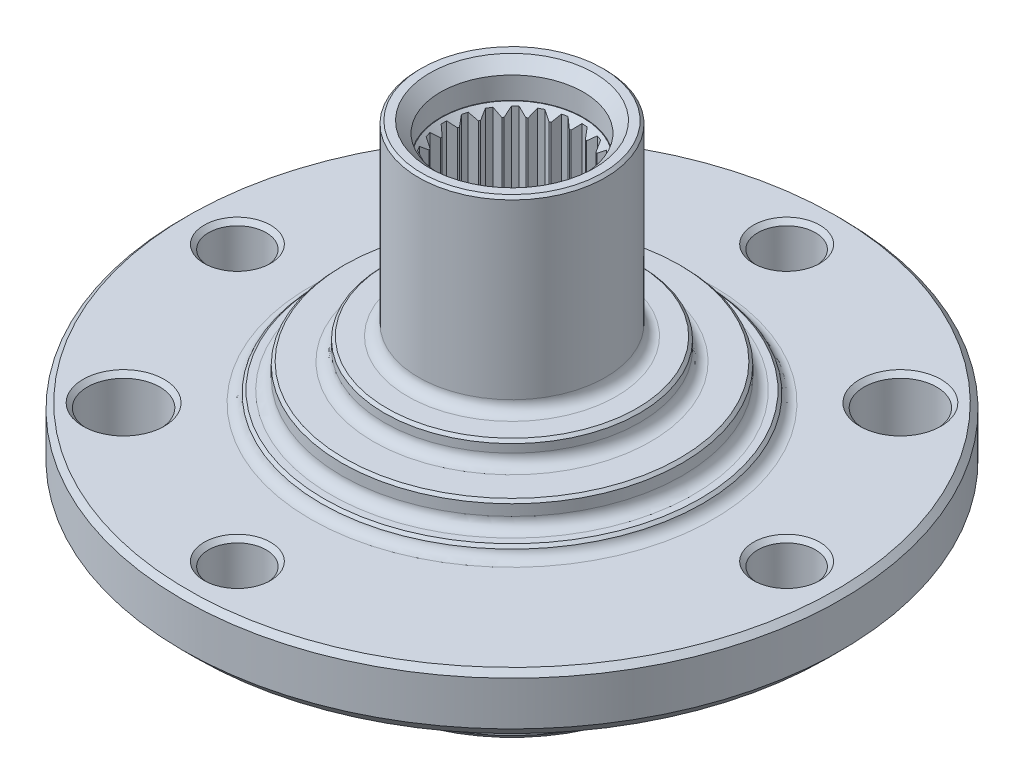
from build123d import *

# Parameters (mm, degrees)
CHANFRO10_SIZE        = 1.5
CHANFRO11_SIZE        = 1.5
CORTE_EXTRUS_O2_DEPTH = 104.923048454
CHANFRO1_SIZE         = 1
CHANFRO2_SIZE         = 0.5
CHANFRO3_SIZE         = 0.5
CHANFRO4_SIZE         = 2
FILETE1_R             = 2
CHANFRO6_SIZE         = 2.5
FILETE2_R             = 1.5
CHANFRO7_SIZE         = 1
FILETE3_R             = 1.5
ESBO_O2_R             = 5.25
ESBO_O2_R_2           = 6.6
ESBO_O2_R_3           = 2.5
CORTE_EXTRUS_O1_DEPTH = 102.666120217
CHANFRO9_SIZE         = 0.8
FILETE5_R             = 2


with BuildPart() as part:
    # Esboço1 → Revolução1 (revolve)
    with BuildSketch(Plane.XY, mode=Mode.PRIVATE) as revolu_o1_sk:
        Polygon((13, 44.5), (13, 38.5), (11.4, 38.5), (11.4, -15.5), (23.5, -15.5), (23.5, -33.5), (28.25, -33.5), (28.25, -11.5), (60, -11.5), (60, 0), (34.75, 0), (34.75, 2), (31, 2), (31, 6.5), (23.25, 6.5), (23.25, 10.5), (17, 10.5), (17, 44.5), align=None)
    revolve(revolu_o1_sk.sketch.rotate(Axis((0, 54.747648262, 0), (0, -1, 0)), 90), axis=Axis((0, 54.747648262, 0), (0, -1, 0)))

    # Chanfro10
    chanfro10_edges = [part.edges().sort_by_distance(p)[0] for p in [
        (0, 38.5, -11.4),
    ]]
    chamfer(chanfro10_edges, length=CHANFRO10_SIZE)

    # Chanfro11
    chanfro11_edges = [part.edges().sort_by_distance(p)[0] for p in [
        (0, -15.5, -11.4),
    ]]
    chamfer(chanfro11_edges, length=CHANFRO11_SIZE)

    # Esboço4 → Corte-extrusão2 (cut, through all)
    with BuildSketch(Plane.XZ.offset(15.5)):
        Polygon((-12.4, 0.5), (-12.4, 0), (-12.4, -0.5), (-11.313708499, -1.4), (-11.313708499, 1.4), align=None)
        Polygon((-11.805275978, 3.826938606), (-11.940174363, 3.345479962), (-12.075072749, 2.864021319), (-11.271880977, 1.704317821), (-10.516450018, 4.400486225), align=None)
        Polygon((-10.335008641, 6.870050683), (-10.594800616, 6.44284098), (-10.854592591, 6.015631278), (-10.394069609, 4.682234185), (-8.939234549, 7.074608518), align=None)
        Polygon((-8.098240994, 9.403642529), (-8.463658976, 9.062365957), (-8.829076958, 8.721089385), (-8.745377647, 7.31289066), (-6.699036947, 9.224039461), align=None)
        Polygon((-5.260863859, 11.239809227), (-5.704806468, 11.009776708), (-6.148749077, 10.779744189), (-6.448081033, 9.401183489), (-3.962002422, 10.689365594), align=None)
        Polygon((-2.033312518, 12.242370694), (-2.522854562, 12.140642687), (-3.012396606, 12.038914681), (-3.672559747, 10.792233546), (-0.931124301, 11.361910382), align=None)
        Polygon((1.34504031, 12.336971531), (0.846205926, 12.371092738), (0.347371541, 12.405213945), (-0.624661505, 11.382873012), (2.168811049, 11.191794254), align=None)
        Polygon((4.623637652, 11.516595628), (4.152507191, 11.684035434), (3.68137673, 11.85147524), (2.469565023, 11.12929686), (5.107895605, 10.191633946), align=None)
        Polygon((7.559320941, 9.842086512), (7.150835994, 10.130426673), (6.742351048, 10.418766834), (5.380635211, 10.050311673), (7.668150912, 8.435606771), align=None)
        Polygon((9.934363977, 7.437634864), (9.618820005, 7.82549051), (9.303276033, 8.213346155), (7.8926483, 8.225940846), (9.659694544, 6.053949232), align=None)
        Polygon((11.572620684, 4.481567863), (11.373420139, 4.940173514), (11.174219594, 5.398779165), (9.819299771, 5.791489618), (10.934822823, 3.223297974), align=None)
        Polygon((12.352589055, 1.193123476), (12.284505731, 1.688466449), (12.216422406, 2.183809422), (11.017698699, 2.9275101), (11.398965316, 0.153589451), align=None)
        Polygon((12.216422406, -2.183809422), (12.284505731, -1.688466449), (12.352589055, -1.193123476), (11.398965316, -0.153589451), (11.017698699, -2.9275101), align=None)
        Polygon((11.174219594, -5.398779165), (11.373420139, -4.940173514), (11.572620684, -4.481567863), (10.934822823, -3.223297974), (9.819299771, -5.791489618), align=None)
        Polygon((9.303276033, -8.213346155), (9.618820005, -7.82549051), (9.934363977, -7.437634864), (9.659694544, -6.053949232), (7.8926483, -8.225940846), align=None)
        Polygon((6.742351048, -10.418766834), (7.150835994, -10.130426673), (7.559320941, -9.842086512), (7.668150912, -8.435606771), (5.380635211, -10.050311673), align=None)
        Polygon((3.68137673, -11.85147524), (4.152507191, -11.684035434), (4.623637652, -11.516595628), (5.107895605, -10.191633946), (2.469565023, -11.12929686), align=None)
        Polygon((0.347371541, -12.405213945), (0.846205926, -12.371092738), (1.34504031, -12.336971531), (2.168811049, -11.191794254), (-0.624661505, -11.382873012), align=None)
        Polygon((-3.012396606, -12.038914681), (-2.522854562, -12.140642687), (-2.033312518, -12.242370694), (-0.931124301, -11.361910382), (-3.672559747, -10.792233546), align=None)
        Polygon((-6.148749077, -10.779744189), (-5.704806468, -11.009776708), (-5.260863859, -11.239809227), (-3.962002422, -10.689365594), (-6.448081033, -9.401183489), align=None)
        Polygon((-8.829076958, -8.721089385), (-8.463658976, -9.062365957), (-8.098240994, -9.403642529), (-6.699036947, -9.224039461), (-8.745377647, -7.31289066), align=None)
        Polygon((-10.854592591, -6.015631278), (-10.594800616, -6.44284098), (-10.335008641, -6.870050683), (-8.939234549, -7.074608518), (-10.394069609, -4.682234185), align=None)
        Polygon((-12.075072749, -2.864021319), (-11.940174363, -3.345479962), (-11.805275978, -3.826938606), (-10.516450018, -4.400486225), (-11.271880977, -1.704317821), align=None)
    extrude(amount=-CORTE_EXTRUS_O2_DEPTH, mode=Mode.SUBTRACT)

    # Chanfro1
    chanfro1_edges = [part.edges().sort_by_distance(p)[0] for p in [
        (0, 0, -60),
    ]]
    chamfer(chanfro1_edges, length=CHANFRO1_SIZE)

    # Chanfro2
    chanfro2_edges = [part.edges().sort_by_distance(p)[0] for p in [
        (0, 10.5, -23.25),
        (0, 6.5, -31),
        (0, 2, -34.75),
    ]]
    chamfer(chanfro2_edges, length=CHANFRO2_SIZE)

    # Chanfro3
    chanfro3_edges = [part.edges().sort_by_distance(p)[0] for p in [
        (0, 44.5, -17),
    ]]
    chamfer(chanfro3_edges, length=CHANFRO3_SIZE)

    # Chanfro4
    chanfro4_edges = [part.edges().sort_by_distance(p)[0] for p in [
        (0, 44.5, -13),
    ]]
    chamfer(chanfro4_edges, length=CHANFRO4_SIZE)

    # Filete1
    filete1_edges = [part.edges().sort_by_distance(p)[0] for p in [
        (0, 10.5, -17),
    ]]
    fillet(filete1_edges, radius=FILETE1_R)

    # Chanfro6
    chanfro6_edges = [part.edges().sort_by_distance(p)[0] for p in [
        (0, -11.5, -60),
    ]]
    chamfer(chanfro6_edges, length=CHANFRO6_SIZE)

    # Filete2
    filete2_edges = [part.edges().sort_by_distance(p)[0] for p in [
        (0, -11.5, -28.25),
    ]]
    fillet(filete2_edges, radius=FILETE2_R)

    # Chanfro7
    chanfro7_edges = [part.edges().sort_by_distance(p)[0] for p in [
        (0, -33.5, -28.25),
        (0, -33.5, -23.5),
    ]]
    chamfer(chanfro7_edges, length=CHANFRO7_SIZE)

    # Filete3
    filete3_edges = [part.edges().sort_by_distance(p)[0] for p in [
        (0, -15.5, -23.5),
    ]]
    fillet(filete3_edges, radius=FILETE3_R)

    # Esboço2 → Corte-extrusão1 (cut, through all)
    with BuildSketch(Plane.XZ.offset(11.5)):
        with Locations(Location((0, 50, 0), (0, 0, 270))):
            Circle(ESBO_O2_R)
        with Locations(Location((50, 0, 0), (0, 0, 270))):
            Circle(ESBO_O2_R)
        with Locations(Location((0, -50, 0), (0, 0, 270))):
            Circle(ESBO_O2_R)
        with Locations(Location((-50, 0, 0), (0, 0, 270))):
            Circle(ESBO_O2_R)
        with Locations(Location((35.355339059, -35.355339059, 0), (0, 0, 270))):
            Circle(ESBO_O2_R_2)
        with Locations(Location((-35.355339059, -35.355339059, 0), (0, 0, 270))):
            Circle(ESBO_O2_R_3)
        with Locations(Location((-35.355339059, 35.355339059, 0), (0, 0, 270))):
            Circle(ESBO_O2_R_2)
    extrude(amount=-CORTE_EXTRUS_O1_DEPTH, mode=Mode.SUBTRACT)

    # Chanfro9
    chanfro9_edges = [part.edges().sort_by_distance(p)[0] for p in [
        (0, 0, 55.25),
        (0, -11.5, 55.25),
        (50, 0, 5.25),
        (50, -11.5, 5.25),
        (0, 0, -44.75),
        (0, -11.5, -44.75),
        (-50, 0, 5.25),
        (-50, -11.5, 5.25),
        (35.355339059, 0, -28.755339059),
        (35.355339059, -11.5, -28.755339059),
        (-35.355339059, 0, -32.855339059),
        (-35.355339059, -11.5, -32.855339059),
        (-35.355339059, 0, 41.955339059),
        (-35.355339059, -11.5, 41.955339059),
    ]]
    chamfer(chanfro9_edges, length=CHANFRO9_SIZE)

    # Filete4: read off the stored shape, not the designer's step
    # Filete4 outline → Filete4 (revolve)
    with BuildSketch(Plane.XY):
        with BuildLine():
            Line((34.75, 0), (36.686491673, 0))
            ThreePointArc((36.686491673, 0), (35.461746802, 0.41886117), (34.75, 1.5))
            Line((34.75, 1.5), (34.75, 0))
        make_face()
    revolve(axis=Axis((0, 0, 0), (0, 1, 0)))

    # Filete5
    filete5_edges = [part.edges().sort_by_distance(p)[0] for p in [
        (0, 6.5, -23.25),
        (0, 2, -31),
    ]]
    fillet(filete5_edges, radius=FILETE5_R)


solid = part.part
